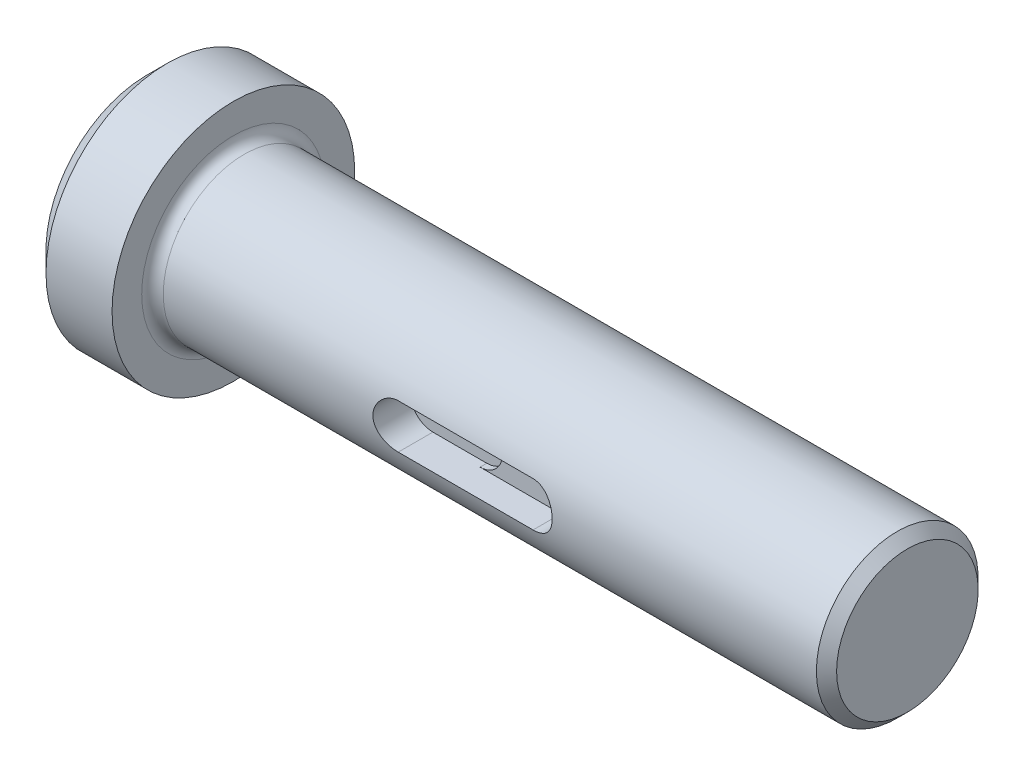
from build123d import *

# Parameters (mm, degrees)
HEADCHAMFER_SIZE   = 1.5
CUT_EXTRUDE1_DEPTH = 2.3
CUT_EXTRUDE2_DEPTH = 2.8
BODYCHAMFER_SIZE   = 0.75


with BuildPart() as part:
    # Sketch2 → Base (revolve)
    with BuildSketch(Plane.XY):
        with BuildLine():
            Line((0, 0), (0, 9))
            Line((0, 9), (6.4, 9))
            Line((6.4, 9), (6.4, 6.8))
            ThreePointArc((6.4, 6.8), (6.634314575, 6.234314575), (7.2, 6))
            Line((7.2, 6), (56.4, 6))
            Line((56.4, 6), (56.4, 0))
            Line((56.4, 0), (0, 0))
        make_face()
    revolve(axis=Axis((-56.067516779, 0, 0), (1, 0, 0)))

    # HeadChamfer
    headchamfer_edges = [part.edges().sort_by_distance(p)[0] for p in [
        (0, -9, 0),
    ]]
    chamfer(headchamfer_edges, length=HEADCHAMFER_SIZE)

    # Sketch3 → Cut-Extrude1 (cut)
    with BuildSketch(Plane.XY.offset(6)):
        with BuildLine():
            Line((24.4, 1.65), (34.4, 1.65))
            ThreePointArc((34.4, 1.65), (36.05, 0), (34.4, -1.65))
            Line((34.4, -1.65), (24.4, -1.65))
            ThreePointArc((24.4, -1.65), (22.75, 0), (24.4, 1.65))
        make_face()
    extrude(amount=-CUT_EXTRUDE1_DEPTH, mode=Mode.SUBTRACT)

    # Sketch4 → Cut-Extrude2 (cut)
    with BuildSketch(Plane.XY.offset(6)):
        with BuildLine():
            Line((24.4, 1.65), (28.4, 1.65))
            ThreePointArc((28.4, 1.65), (30.05, 0), (28.4, -1.65))
            Line((28.4, -1.65), (24.4, -1.65))
            ThreePointArc((24.4, -1.65), (22.75, 0), (24.4, 1.65))
        make_face()
    extrude(amount=-CUT_EXTRUDE2_DEPTH, mode=Mode.SUBTRACT)

    # BodyChamfer
    bodychamfer_edges = [part.edges().sort_by_distance(p)[0] for p in [
        (56.4, -6, 0),
    ]]
    chamfer(bodychamfer_edges, length=BODYCHAMFER_SIZE)


solid = part.part
